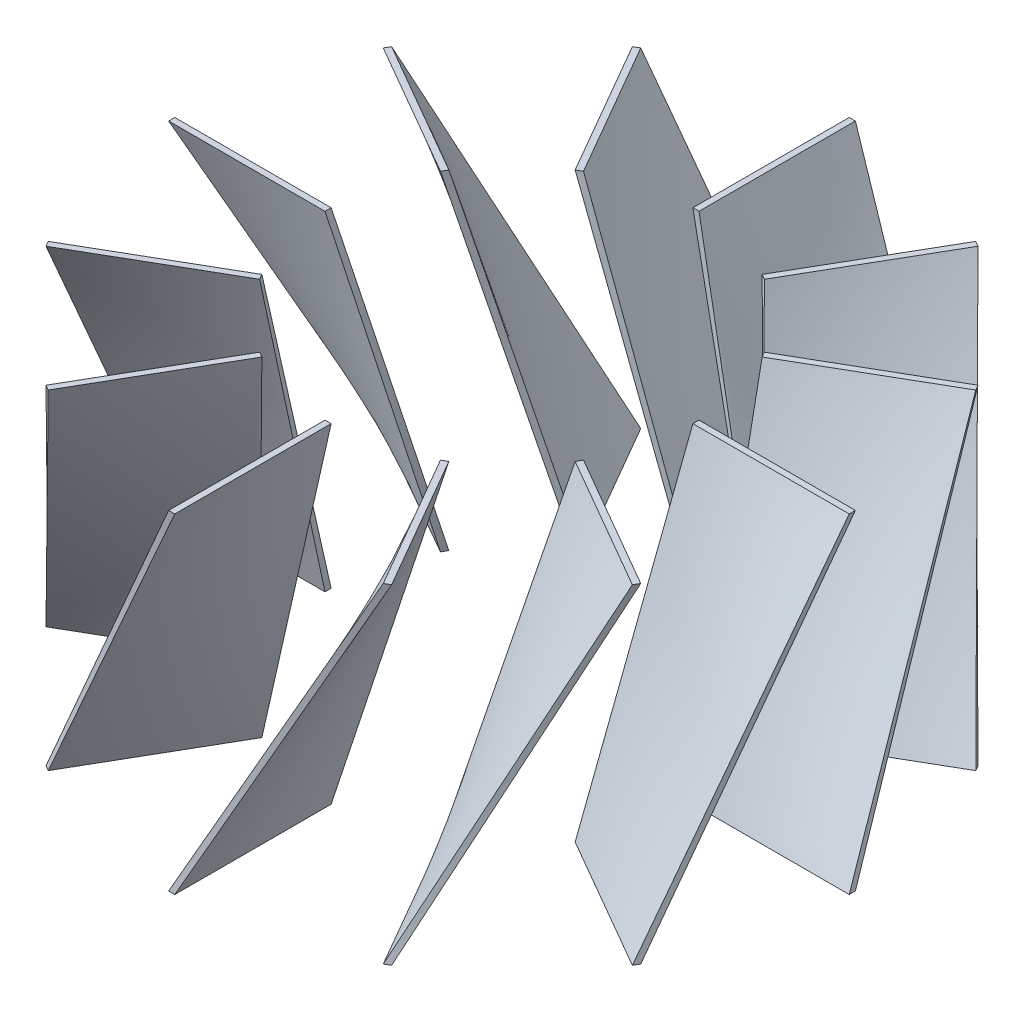
from build123d import *

# Parameters (mm, degrees)
CIRPATTERN2_COUNT = 12


with BuildPart() as part:
    # Sketch1 for Loft1 → Loft1 section 0
    with BuildSketch(Plane(origin=(0, 0, 0), x_dir=(1, 0, 0), z_dir=(0, 1, 0))):
        with BuildLine():
            Line((30.475766373, 0.508), (56.385711665, 0.508))
            # circular arc as an exact rational Bezier (weights 1, cos(half-angle), 1)
            Bezier((56.385711665, 0.508), (56.390288428, 0), (56.385711665, -0.508), weights=[1, 0.999959418, 1])
            Line((56.385711665, -0.508), (30.475766373, -0.508))
            Bezier((30.475766373, -0.508), (30.484234215, 0), (30.475766373, 0.508), weights=[1, 0.999861101, 1])
        make_face()
    # Sketch2 for Loft1 → Loft1 section 1
    with BuildSketch(Plane(origin=(0, 54.61, 0), x_dir=(1, 0, 0), z_dir=(0, 1, 0))):
        with BuildLine():
            Line((26.646787879, 14.797942281), (49.085458713, 27.752914928))
            Bezier((49.085458713, 27.752914928), (48.835422305, 28.195144214), (48.577458713, 28.632796738), weights=[1, 0.999959418, 1])
            Line((48.577458713, 28.632796738), (26.138787879, 15.677824091))
            Bezier((26.138787879, 15.677824091), (26.400121246, 15.242117108), (26.646787879, 14.797942281), weights=[1, 0.999861101, 1])
        make_face()
    loft()


with BuildPart() as cirpattern2_1:
    # CirPattern2: pattern copy
    add(part.part.rotate(Axis((0, 0, 0), (0, 1, 0)), 1 * 360 / CIRPATTERN2_COUNT))


with BuildPart() as cirpattern2_2:
    # CirPattern2: pattern copy
    add(part.part.rotate(Axis((0, 0, 0), (0, 1, 0)), 2 * 360 / CIRPATTERN2_COUNT))


with BuildPart() as cirpattern2_3:
    # CirPattern2: pattern copy
    add(part.part.rotate(Axis((0, 0, 0), (0, 1, 0)), 3 * 360 / CIRPATTERN2_COUNT))


with BuildPart() as cirpattern2_4:
    # CirPattern2: pattern copy
    add(part.part.rotate(Axis((0, 0, 0), (0, 1, 0)), 4 * 360 / CIRPATTERN2_COUNT))


with BuildPart() as cirpattern2_5:
    # CirPattern2: pattern copy
    add(part.part.rotate(Axis((0, 0, 0), (0, 1, 0)), 5 * 360 / CIRPATTERN2_COUNT))


with BuildPart() as cirpattern2_6:
    # CirPattern2: pattern copy
    add(part.part.rotate(Axis((0, 0, 0), (0, 1, 0)), 6 * 360 / CIRPATTERN2_COUNT))


with BuildPart() as cirpattern2_7:
    # CirPattern2: pattern copy
    add(part.part.rotate(Axis((0, 0, 0), (0, 1, 0)), 7 * 360 / CIRPATTERN2_COUNT))


with BuildPart() as cirpattern2_8:
    # CirPattern2: pattern copy
    add(part.part.rotate(Axis((0, 0, 0), (0, 1, 0)), 8 * 360 / CIRPATTERN2_COUNT))


with BuildPart() as cirpattern2_9:
    # CirPattern2: pattern copy
    add(part.part.rotate(Axis((0, 0, 0), (0, 1, 0)), 9 * 360 / CIRPATTERN2_COUNT))


with BuildPart() as cirpattern2_10:
    # CirPattern2: pattern copy
    add(part.part.rotate(Axis((0, 0, 0), (0, 1, 0)), 10 * 360 / CIRPATTERN2_COUNT))


with BuildPart() as cirpattern2_11:
    # CirPattern2: pattern copy
    add(part.part.rotate(Axis((0, 0, 0), (0, 1, 0)), 11 * 360 / CIRPATTERN2_COUNT))


solid = Compound([part.part, cirpattern2_1.part, cirpattern2_2.part, cirpattern2_3.part, cirpattern2_4.part, cirpattern2_5.part, cirpattern2_6.part, cirpattern2_7.part, cirpattern2_8.part, cirpattern2_9.part, cirpattern2_10.part, cirpattern2_11.part])
